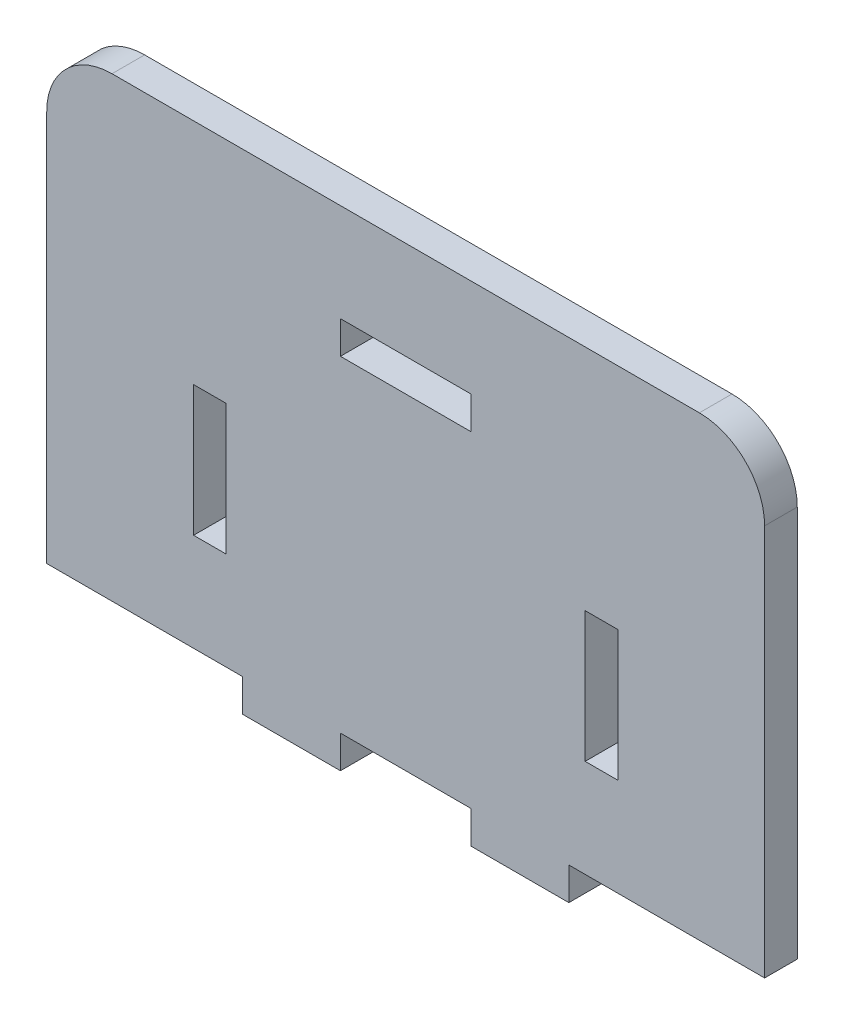
from build123d import *

# Parameters (mm, degrees)
ESQUISSE1_W        = 5
ESQUISSE1_H        = 20
ESQUISSE1_W_2      = 20
ESQUISSE1_H_2      = 5
BOSS_EXTRU_1_DEPTH = 5
CONG_1_R           = 10


with BuildPart() as part:
    # Esquisse1 → Boss.-Extru.1 (new body)
    with BuildSketch(Plane.XY):
        Polygon((-55, 35), (55, 35), (55, -35), (25, -35), (25, -40), (10, -40), (10, -35), (-10, -35), (-10, -40), (-25, -40), (-25, -35), (-55, -35), align=None)
        with Locations((-30, -10)):
            Rectangle(ESQUISSE1_W, ESQUISSE1_H, mode=Mode.SUBTRACT)
        with Locations((30, -10)):
            Rectangle(ESQUISSE1_W, ESQUISSE1_H, mode=Mode.SUBTRACT)
        with Locations((0, 17.5)):
            Rectangle(ESQUISSE1_W_2, ESQUISSE1_H_2, mode=Mode.SUBTRACT)
    extrude(amount=BOSS_EXTRU_1_DEPTH)

    # Congé1
    cong_1_edges = [part.edges().sort_by_distance(p)[0] for p in [
        (-55, 35, 2.5),
        (55, 35, 2.5),
    ]]
    fillet(cong_1_edges, radius=CONG_1_R)


solid = part.part
